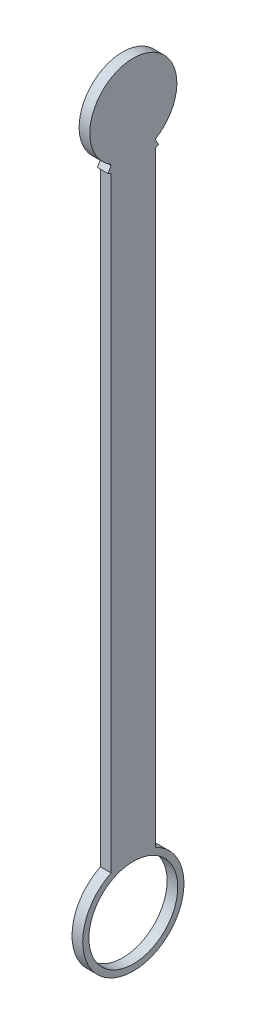
from build123d import *

# Parameters (mm, degrees)
BOSS_EXTRUDE1_DEPTH = 3
SKETCH2_R           = 25
CUT_EXTRUDE1_DEPTH  = 227.381315483


with BuildPart() as part:
    # Sketch1 → Boss-Extrude1 (new, symmetric)
    with BuildSketch(Plane(origin=(0, 0, 0), x_dir=(0, 0, -1), z_dir=(1, 0, 0))):
        with BuildLine():
            Line((12.5, -170.38750305), (12.5, 170.38750305))
            ThreePointArc((12.5, 170.38750305), (13.38309417, 170.837671204), (14.25, 171.318275992))
            Line((14.25, 171.318275992), (12.5, 174.349364905))
            Line((12.5, 174.349364905), (12.5, 174.928692494))
            ThreePointArc((12.5, 174.928692494), (0, 220.5), (-12.5, 174.928692494))
            Line((-12.5, 174.928692494), (-12.5, 174.349364905))
            Line((-12.5, 174.349364905), (-14.25, 171.318275992))
            ThreePointArc((-14.25, 171.318275992), (-13.38309417, 170.837671204), (-12.5, 170.38750305))
            Line((-12.5, 170.38750305), (-12.5, -170.38750305))
            ThreePointArc((-12.5, -170.38750305), (0, -224.5), (12.5, -170.38750305))
        make_face()
    extrude(amount=BOSS_EXTRUDE1_DEPTH, both=True)

    # Sketch2 → Cut-Extrude1 (cut, through all)
    with BuildSketch(Plane(origin=(3, 0, 0), x_dir=(0, 0, -1), z_dir=(1, 0, 0))):
        with Locations((0, -196)):
            Circle(SKETCH2_R)
    extrude(amount=-CUT_EXTRUDE1_DEPTH, mode=Mode.SUBTRACT)


solid = part.part
